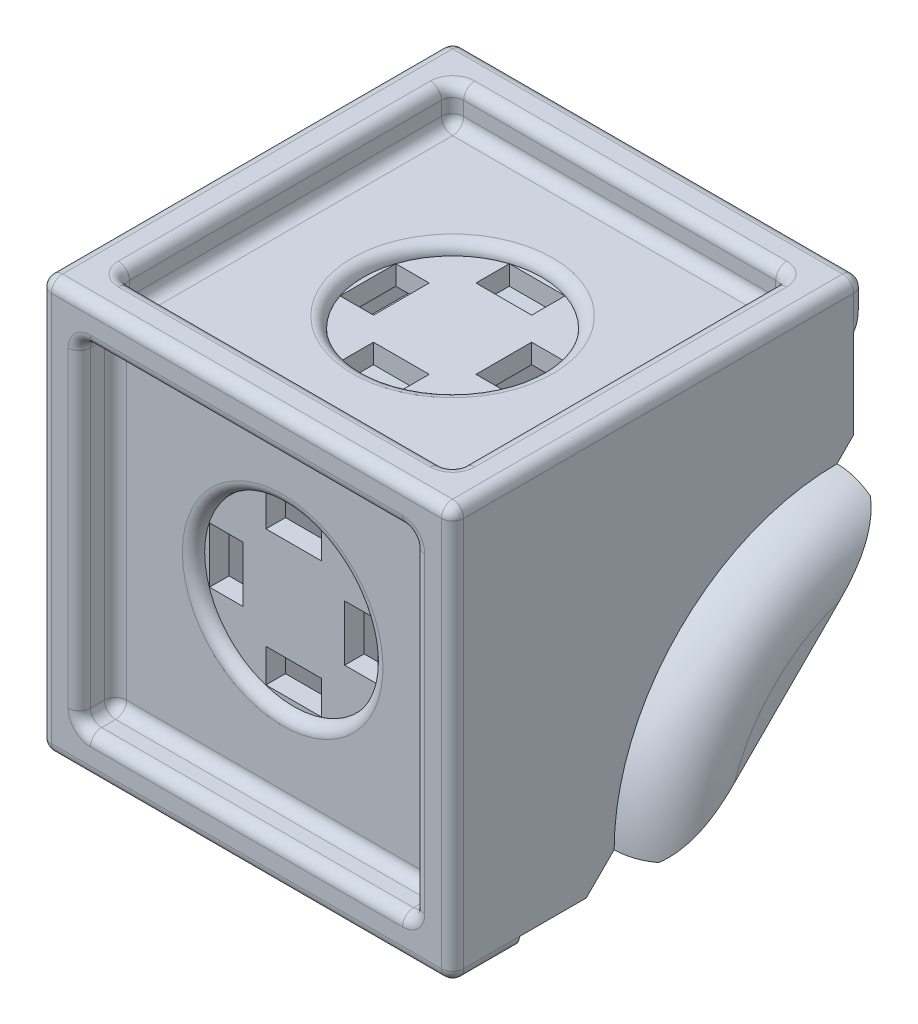
from build123d import *

# Parameters (mm, degrees)
SKETCH1_W           = 18.796
SKETCH1_H           = 18.796
BOSS_EXTRUDE1_DEPTH = 3.048
SKETCH3_W           = 18.796
SKETCH3_H           = 18.796
BOSS_EXTRUDE2_DEPTH = 3.048
SKETCH4_W           = 15.24
SKETCH4_H           = 15.24
CUT_EXTRUDE1_DEPTH  = 1.651
SKETCH5_W           = 15.24
SKETCH5_H           = 15.24
CUT_EXTRUDE2_DEPTH  = 1.651
BOSS_EXTRUDE3_DEPTH = 1.651
FILLET1_R           = 0.508
FILLET2_R           = 0.508
SKETCH7_W           = 2.54
SKETCH7_H           = 1.524
SKETCH7_W_2         = 1.524
SKETCH7_H_2         = 2.54
CUT_EXTRUDE5_DEPTH  = 5.08
SKETCH11_W          = 2.54
SKETCH11_H          = 1.524
SKETCH11_W_2        = 1.524
SKETCH11_H_2        = 2.54
CUT_EXTRUDE6_DEPTH  = 5.08
SKETCH12_R          = 4.064
CUT_EXTRUDE7_DEPTH  = 0.508
FILLET3_R           = 0.508
FILLET4_R           = 0.508
SKETCH13_R          = 4.064
CUT_EXTRUDE8_DEPTH  = 2.159
FILLET5_R           = 0.508
FILLET6_R           = 0.508
BOSS_EXTRUDE4_DEPTH = 15.24
BOSS_EXTRUDE5_DEPTH = 4.3561
CUT_EXTRUDE11_DEPTH = 12.7
BOSS_EXTRUDE6_DEPTH = 2.54
FILLET9_R           = 2.54
FILLET10_START      = -7.747
FILLET10_DEPTH      = 15.494
FILLET10_START_2    = -10
FILLET10_2_DEPTH    = 20
BOSS_EXTRUDE7_DEPTH = 2.54
FILLET11_R          = 2.54


with BuildPart() as part:
    # Sketch1 → Boss-Extrude1 (new body)
    with BuildSketch(Plane.XY):
        Rectangle(SKETCH1_W, SKETCH1_H)
    extrude(amount=-BOSS_EXTRUDE1_DEPTH)

    # Sketch3 → Boss-Extrude2 (add)
    with BuildSketch(Plane(origin=(0, 9.398, 0), x_dir=(1, 0, 0), z_dir=(0, 1, 0))):
        with Locations((0, 9.398)):
            Rectangle(SKETCH3_W, SKETCH3_H)
    extrude(amount=-BOSS_EXTRUDE2_DEPTH)

    # Sketch4 → Cut-Extrude1 (cut)
    with BuildSketch(Plane(origin=(0, 9.398, 0), x_dir=(1, 0, 0), z_dir=(0, 1, 0))):
        with Locations((0, 9.398)):
            Rectangle(SKETCH4_W, SKETCH4_H)
    extrude(amount=-CUT_EXTRUDE1_DEPTH, mode=Mode.SUBTRACT)

    # Sketch5 → Cut-Extrude2 (cut)
    with BuildSketch(Plane.XY):
        Rectangle(SKETCH5_W, SKETCH5_H)
    extrude(amount=-CUT_EXTRUDE2_DEPTH, mode=Mode.SUBTRACT)

    # Sketch8 → Boss-Extrude3 (add)
    with BuildSketch(Plane(origin=(9.398, 0, 0), x_dir=(0, 0, -1), z_dir=(1, 0, 0))):
        Polygon((3.048, 6.35), (3.048, -8.89), (6.096, -8.89), (7.366, -7.62), (7.874, -7.62), (17.526, 2.032), (17.526, 2.54), (18.288, 3.302), (18.288, 6.35), align=None)
    boss_extrude3 = extrude(amount=-BOSS_EXTRUDE3_DEPTH)

    # Fillet1
    fillet1_edges = [part.edges().sort_by_distance(p)[0] for p in [
        (7.62, 8.5725, -1.778),
        (-7.62, 8.5725, -1.778),
        (-7.62, 8.5725, -17.018),
        (7.62, 8.5725, -17.018),
    ]]
    fillet(fillet1_edges, radius=FILLET1_R)

    # Fillet2
    fillet2_edges = [part.edges().sort_by_distance(p)[0] for p in [
        (-7.62, -7.62, -0.8255),
        (-7.62, 7.62, -0.8255),
        (7.62, 7.62, -0.8255),
        (7.62, -7.62, -0.8255),
    ]]
    fillet(fillet2_edges, radius=FILLET2_R)

    # Mirror1: Boss-Extrude3 across plane
    add(boss_extrude3.mirror(Plane(origin=(0, 0, 0), x_dir=(0, 0, 1), z_dir=(1, 0, 0))))

    # Sketch7 → Cut-Extrude5 (cut)
    with BuildSketch(Plane.XY):
        with Locations((0, 3.08066434)):
            Rectangle(SKETCH7_W, SKETCH7_H)
        with Locations((3.08066434, 0)):
            Rectangle(SKETCH7_W_2, SKETCH7_H_2)
        with Locations((0, -3.08066434)):
            Rectangle(SKETCH7_W, SKETCH7_H)
        with Locations((-3.08066434, 0)):
            Rectangle(SKETCH7_W_2, SKETCH7_H_2)
    extrude(amount=-CUT_EXTRUDE5_DEPTH, mode=Mode.SUBTRACT)

    # Sketch11 → Cut-Extrude6 (cut)
    with BuildSketch(Plane(origin=(0, 9.398, 0), x_dir=(1, 0, 0), z_dir=(0, 1, 0))):
        with Locations((0, 12.496465775)):
            Rectangle(SKETCH11_W, SKETCH11_H)
        with Locations((3.098465775, 9.398)):
            Rectangle(SKETCH11_W_2, SKETCH11_H_2)
        with Locations((0, 6.299534225)):
            Rectangle(SKETCH11_W, SKETCH11_H)
        with Locations((-3.098465775, 9.398)):
            Rectangle(SKETCH11_W_2, SKETCH11_H_2)
    extrude(amount=-CUT_EXTRUDE6_DEPTH, mode=Mode.SUBTRACT)

    # Sketch12 → Cut-Extrude7 (cut)
    with BuildSketch(Plane(origin=(0, 7.747, 0), x_dir=(1, 0, 0), z_dir=(0, 1, 0))):
        with Locations(Location((0, 9.398, 0), (0, 0, 270))):
            Circle(SKETCH12_R)
    extrude(amount=-CUT_EXTRUDE7_DEPTH, mode=Mode.SUBTRACT)

    # Fillet3
    fillet3_edges = [part.edges().sort_by_distance(p)[0] for p in [
        (0, 7.747, -13.462),
    ]]
    fillet(fillet3_edges, radius=FILLET3_R - 0.0001)  # a hair under: the kernel refuses the full size

    # Fillet4
    fillet4_edges = [part.edges().sort_by_distance(p)[0] for p in [
        (-7.62, 0, 0),
        (-7.62, 0, -1.651),
        (0, 7.62, 0),
        (0, 7.62, -1.651),
        (0, -7.62, -1.651),
        (7.62, 0, -1.651),
        (7.471210245, 7.471210245, -1.651),
        (-7.471210245, -7.471210245, -1.651),
        (7.471210245, -7.471210245, -1.651),
        (-7.471210245, 7.471210245, -1.651),
        (7.62, 0, 0),
        (0, -7.62, 0),
        (-7.471210245, 7.471210245, 0),
        (7.471210245, -7.471210245, 0),
        (-7.471210245, -7.471210245, 0),
        (7.471210245, 7.471210245, 0),
        (0, 9.398, -1.778),
        (0, 7.747, -1.778),
        (-7.62, 9.398, -9.398),
        (-7.62, 7.747, -9.398),
        (7.62, 7.747, -9.398),
        (0, 7.747, -17.018),
        (-7.471210245, 7.747, -16.869210245),
        (7.471210245, 7.747, -16.869210245),
        (7.471210245, 7.747, -1.926789755),
        (-7.471210245, 7.747, -1.926789755),
        (7.62, 9.398, -9.398),
        (0, 9.398, -17.018),
        (-7.471210245, 9.398, -1.926789755),
        (7.471210245, 9.398, -1.926789755),
        (7.471210245, 9.398, -16.869210245),
        (-7.471210245, 9.398, -16.869210245),
    ]]
    fillet(fillet4_edges, radius=FILLET4_R)

    # Sketch13 → Cut-Extrude8 (cut)
    with BuildSketch(Plane.XY):
        Circle(SKETCH13_R)
    extrude(amount=-CUT_EXTRUDE8_DEPTH, mode=Mode.SUBTRACT)

    # Fillet5
    fillet5_edges = [part.edges().sort_by_distance(p)[0] for p in [
        (-4.064, 0, -1.651),
    ]]
    fillet(fillet5_edges, radius=FILLET5_R - 0.0001)  # a hair under: the kernel refuses the full size

    # Fillet6
    fillet6_edges = [part.edges().sort_by_distance(p)[0] for p in [
        (-9.398, -9.398, -1.524),
        (-9.398, 7.874, -18.796),
        (0, 9.398, -18.796),
        (-9.398, 9.398, -9.398),
        (-9.398, 0, 0),
        (9.398, 7.874, -18.796),
        (9.398, -9.398, -1.524),
        (0, -9.398, 0),
        (9.398, 0, 0),
        (9.398, 9.398, -9.398),
        (0, 9.398, 0),
    ]]
    fillet(fillet6_edges, radius=FILLET6_R)

    # Sketch14 → Boss-Extrude4 (add)
    with BuildSketch(Plane(origin=(0, 0, -3.048), x_dir=(-1, 0, 0), z_dir=(0, 0, -1))):
        Polygon((-7.747, 0.96249216), (-2.178609242, 1.813398025), (-2.178609242, -6.100026522), (-7.747, -6.100026522), (-7.747, -7.12111356), (-1.582975136, -7.12111356), (1.582975136, -7.12111356), (7.747, -7.12111356), (7.747, -6.100026522), (2.178609242, -6.100026522), (2.178609242, 1.813398025), (7.747, 0.96249216), (7.747, 1.892560342), (1.582975136, 2.834485063), (1.582975136, -6.100026522), (-1.582975136, -6.100026522), (-1.582975136, 2.834485063), (-7.747, 1.892560342), align=None)
    extrude(amount=BOSS_EXTRUDE4_DEPTH)

    # Sketch15 → Boss-Extrude5 (add)
    with BuildSketch(Plane(origin=(2.178609242, 0, 0), x_dir=(0, 0, -1), z_dir=(1, 0, 0))):
        with BuildLine():
            Line((9.029782906, -13.262742395), (9.029782906, 1.135001064))
            Line((9.029782906, 1.135001064), (23.004063321, 1.135001064))
            Line((23.004063321, 1.135001064), (23.004063321, 0.252786391))
            ThreePointArc((23.004063321, 0.252786391), (13.620185086, -3.736867225), (9.982574752, -13.262742395))
            Line((9.982574752, -13.262742395), (9.029782906, -13.262742395))
        make_face()
    extrude(amount=-BOSS_EXTRUDE5_DEPTH)

    # Sketch16 → Cut-Extrude11 (cut, symmetric)
    with BuildSketch(Plane(origin=(2.178609242, 0, 0), x_dir=(0, 0, -1), z_dir=(1, 0, 0))):
        with BuildLine():
            Line((23.004063321, 0.252786391), (23.004063321, -12.777731634))
            Line((23.004063321, -12.777731634), (9.973545297, -12.777731634))
            ThreePointArc((9.973545297, -12.777731634), (13.790095664, -3.563763976), (23.004063321, 0.252786391))
        make_face()
    extrude(amount=CUT_EXTRUDE11_DEPTH, both=True, mode=Mode.SUBTRACT)

    # Sketch17 → Boss-Extrude6 (add)
    with BuildSketch(Plane(origin=(9.398, 0, 0), x_dir=(0, 0, -1), z_dir=(1, 0, 0))):
        with BuildLine():
            Line((7.874, -7.62), (7.366, -7.62))
            ThreePointArc((7.366, -7.62), (10.341795103, -0.435795103), (17.526, 2.54))
            Line((17.526, 2.54), (17.526, 2.032))
            Line((17.526, 2.032), (7.874, -7.62))
        make_face()
    extrude(amount=BOSS_EXTRUDE6_DEPTH)

    # Fillet9
    # the kernel refuses this fillet: 2.54 mm, written as the material it takes off along each edge
    with BuildSketch(Plane(origin=(11.938, -7.62, -17.526), x_dir=(0, -0.5853008610590893, 0.8108161949810133), z_dir=(0, -0.8108161949810133, -0.5853008610590893))) as fillet9_piece_1:
        with BuildLine():
            CenterArc((10.16 - FILLET9_R, FILLET9_R), FILLET9_R, 270, 90)
            Line((10.16 - FILLET9_R, 0), (10.16, 0))
            Line((10.16, 0), (10.16, FILLET9_R))
        make_face()
    revolve(axis=Axis((11.938, -7.62, -17.526), (-1, 0, 0)), revolution_arc=161.648494619, mode=Mode.SUBTRACT)

    # Fillet10: read off the stored shape, not the designer's step
    # Fillet10 outline → Fillet10 (cut)
    with BuildSketch(Plane.YZ.offset(FILLET10_START)):
        with BuildLine():
            Line((6.35, -16.256), (6.35, -18.796))
            Line((6.35, -18.796), (8.89, -18.796))
            ThreePointArc((8.89, -18.796), (7.093948776, -18.052051224), (6.35, -16.256))
        make_face()
    extrude(amount=FILLET10_DEPTH, mode=Mode.SUBTRACT)

    # Fillet10 2 outline → Fillet10 2 (cut)
    with BuildSketch(Plane.YZ.offset(FILLET10_START_2)):
        with BuildLine():
            Line((7.366, -18.288), (6.35, -18.288))
            Line((6.35, -18.288), (6.35, -18.796))
            Line((6.35, -18.796), (8.89, -18.796))
            ThreePointArc((8.89, -18.796), (8.086781474, -18.665655577), (7.366, -18.288))
        make_face()
    extrude(amount=FILLET10_2_DEPTH, mode=Mode.SUBTRACT)

    # Mirror2: Boss-Extrude3 across plane
    add(boss_extrude3.mirror(Plane(origin=(0, 0, 0), x_dir=(0, 0, 1), z_dir=(1, 0, 0))))

    # Sketch19 → Boss-Extrude7 (add)
    with BuildSketch(Plane.ZY.offset(9.398)):
        with BuildLine():
            Line((-17.526, 2.032), (-17.526, 2.54))
            ThreePointArc((-17.526, 2.54), (-10.341795103, -0.435795103), (-7.366, -7.62))
            Line((-7.366, -7.62), (-7.874, -7.62))
            Line((-7.874, -7.62), (-17.526, 2.032))
        make_face()
    extrude(amount=BOSS_EXTRUDE7_DEPTH)

    # Fillet11
    fillet11_edges = [part.edges().sort_by_distance(p)[0] for p in [
        (-11.938, -0.435795103, -10.341795103),
    ]]
    fillet(fillet11_edges, radius=FILLET11_R - 0.0001)  # a hair under: the kernel refuses the full size


solid = part.part
